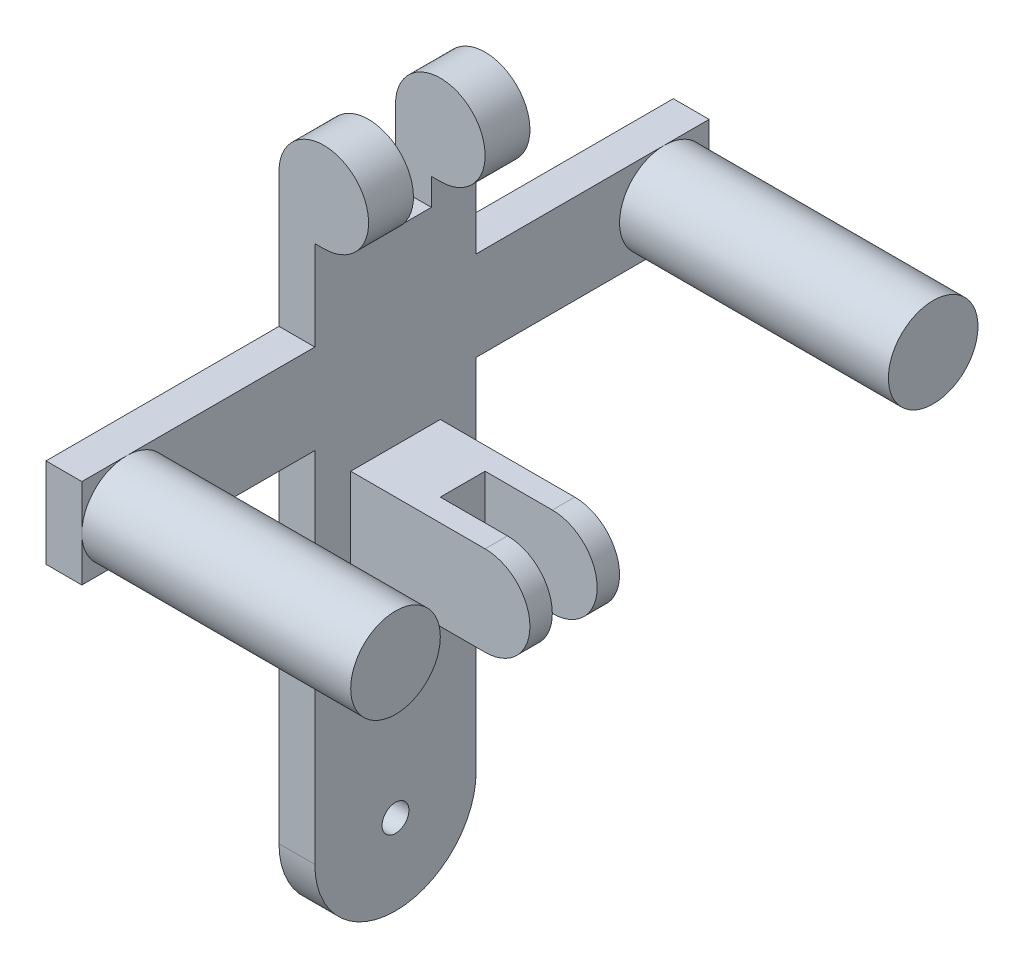
from build123d import *

# Parameters (mm, degrees)
SKETCH_1_R          = 3
EXTRUDE_1_DEPTH     = 8
SKETCH_3_W          = 12
SKETCH_3_H          = 20
EXTRUDE_2_DEPTH     = 36
SKETCH_8_R          = 10
EXTRUDE_4_DEPTH     = 60
EXTRUDE_4_2_DEPTH   = 60
CUT_EXTRUDE_1_DEPTH = 179.795973109
SKETCH_12_W         = 8
SKETCH_12_H         = 20
EXTRUDE_5_DEPTH     = 70
SKETCH_13_W         = 16
SKETCH_13_H         = 35.268464788
CUT_EXTRUDE_2_DEPTH = 140
SKETCH_14_W         = 20
SKETCH_14_H         = 20
EXTRUDE_6_DEPTH     = 40
CUT_EXTRUDE_3_DEPTH = 40
SKETCH_16_W         = 28.583727007
SKETCH_16_H         = 28.583727007
CUT_EXTRUDE_4_DEPTH = 5


with BuildPart() as part:
    # 草图1 → 凸台-拉伸1 (new body)
    with BuildSketch(Plane(origin=(0, 0, 0), x_dir=(0, 0, -1), z_dir=(1, 0, 0))):
        with BuildLine():
            Line((-18, 0), (-18, 140))
            Line((-18, 140), (18, 140))
            Line((18, 140), (18, 0))
            ThreePointArc((18, 0), (0, -18), (-18, 0))
        make_face()
        Circle(SKETCH_1_R, mode=Mode.SUBTRACT)
    extrude(amount=EXTRUDE_1_DEPTH)

    # 草图3 → 凸台-拉伸2 (add)
    with BuildSketch(Plane(origin=(0, 0, -18), x_dir=(-1, 0, 0), z_dir=(0, 0, -1))):
        with Locations((-14, 130)):
            Rectangle(SKETCH_3_W, SKETCH_3_H)
    extrude(amount=-EXTRUDE_2_DEPTH)

    # 草图10 → 切除-拉伸1 (cut, through all)
    with BuildSketch(Plane.XY.offset(18)):
        with BuildLine():
            Line((0, 130), (-3.859245882, 130))
            Line((-3.859245882, 130), (-3.859245882, 144.839572577))
            Line((-3.859245882, 144.839572577), (22.991832782, 144.839572577))
            Line((22.991832782, 144.839572577), (22.991832782, 116.883342809))
            Line((22.991832782, 116.883342809), (10, 116.883342809))
            Line((10, 116.883342809), (10, 120))
            ThreePointArc((10, 120), (17.071067812, 137.071067812), (0, 130))
        make_face()
    extrude(amount=-CUT_EXTRUDE_1_DEPTH, mode=Mode.SUBTRACT)



with BuildPart() as body_2:
    # 草图8 → 凸台-拉伸4 (new body)
    with BuildSketch(Plane(origin=(8, 0, 0), x_dir=(0, 0, -1), z_dir=(1, 0, 0))):
        with Locations((-60, 90)):
            Circle(SKETCH_8_R)
    extrude(amount=EXTRUDE_4_DEPTH)


with BuildPart() as body_3:
    # 草图8 → Extrude 4 2 (new body)
    with BuildSketch(Plane(origin=(8, 0, 0), x_dir=(0, 0, -1), z_dir=(1, 0, 0))):
        with Locations((60, 90)):
            Circle(SKETCH_8_R)
    extrude(amount=EXTRUDE_4_2_DEPTH)


with BuildPart() as part_1:
    add(part.part)

    add(body_2.part)  # 凸台-拉伸5 merges body 2

    add(body_3.part)  # 凸台-拉伸5 merges body 3
    # 草图12 → 凸台-拉伸5 (add, symmetric)
    with BuildSketch(Plane.XY):
        with Locations((4, 90)):
            Rectangle(SKETCH_12_W, SKETCH_12_H)
    extrude(amount=EXTRUDE_5_DEPTH, both=True)

    # 草图13 → 切除-拉伸2 (cut)
    with BuildSketch(Plane.ZY):
        with Locations((0, 131.634232394)):
            Rectangle(SKETCH_13_W, SKETCH_13_H)
    extrude(amount=-CUT_EXTRUDE_2_DEPTH, mode=Mode.SUBTRACT)

    # 草图14 → 凸台-拉伸6 (add)
    with BuildSketch(Plane(origin=(8, 0, 0), x_dir=(0, 0, -1), z_dir=(1, 0, 0))):
        with Locations((0, 62)):
            Rectangle(SKETCH_14_W, SKETCH_14_H)
    extrude(amount=EXTRUDE_6_DEPTH)

    # 草图15 → 切除-拉伸3 (cut)
    with BuildSketch(Plane(origin=(0, 0, -10), x_dir=(-1, 0, 0), z_dir=(0, 0, -1))):
        with BuildLine():
            Line((-38, 72), (-54.351268728, 72))
            Line((-54.351268728, 72), (-54.351268728, 52))
            Line((-54.351268728, 52), (-38, 52))
            ThreePointArc((-38, 52), (-48, 62), (-38, 72))
        make_face()
    extrude(amount=-CUT_EXTRUDE_3_DEPTH, mode=Mode.SUBTRACT)

    # 草图16 → 切除-拉伸4 (cut, symmetric)
    with BuildSketch(Plane.XY):
        with Locations((37.291863503, 60.532166911)):
            Rectangle(SKETCH_16_W, SKETCH_16_H)
    extrude(amount=CUT_EXTRUDE_4_DEPTH, both=True, mode=Mode.SUBTRACT)


solid = part_1.part
